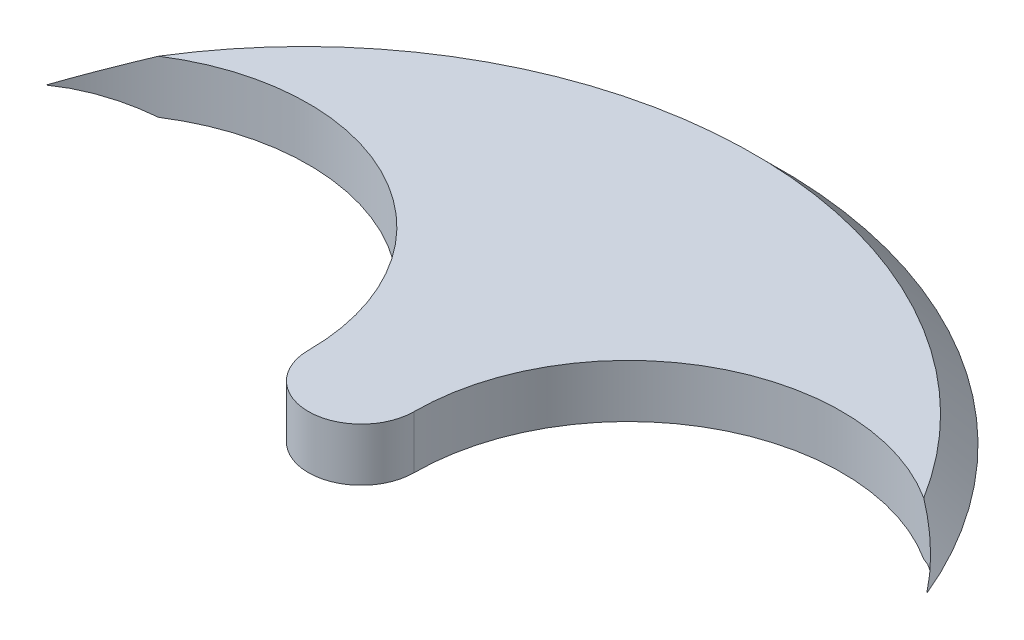
from build123d import *

# Parameters (mm, degrees)
BOSS_EXTRUDE1_DEPTH = 1
CHAMFER1_SIZE       = 1


with BuildPart() as part:
    # Sketch1 → Boss-Extrude1 (new, symmetric)
    with BuildSketch(Plane(origin=(0, 0, 0), x_dir=(1, 0, 0), z_dir=(0, 1, 0))):
        with BuildLine():
            ThreePointArc((16.629831585, 6.888301783), (0, 18), (-16.629831585, 6.888301783))
            ThreePointArc((-16.629831585, 6.888301783), (-7.595646594, 9.851519544), (-2, 2.164784401))
            ThreePointArc((-2, 2.164784401), (0, 0.164784401), (2, 2.164784401))
            ThreePointArc((2, 2.164784401), (7.595646594, 9.851519544), (16.629831585, 6.888301783))
        make_face()
    extrude(amount=BOSS_EXTRUDE1_DEPTH, both=True)

    # Chamfer1
    chamfer1_edges = [part.edges().sort_by_distance(p)[0] for p in [
        (0, -1, -18),
        (0, 1, -18),
    ]]
    chamfer(chamfer1_edges, length=CHAMFER1_SIZE - 0.0001)  # a hair under: the kernel refuses the full size


solid = part.part
